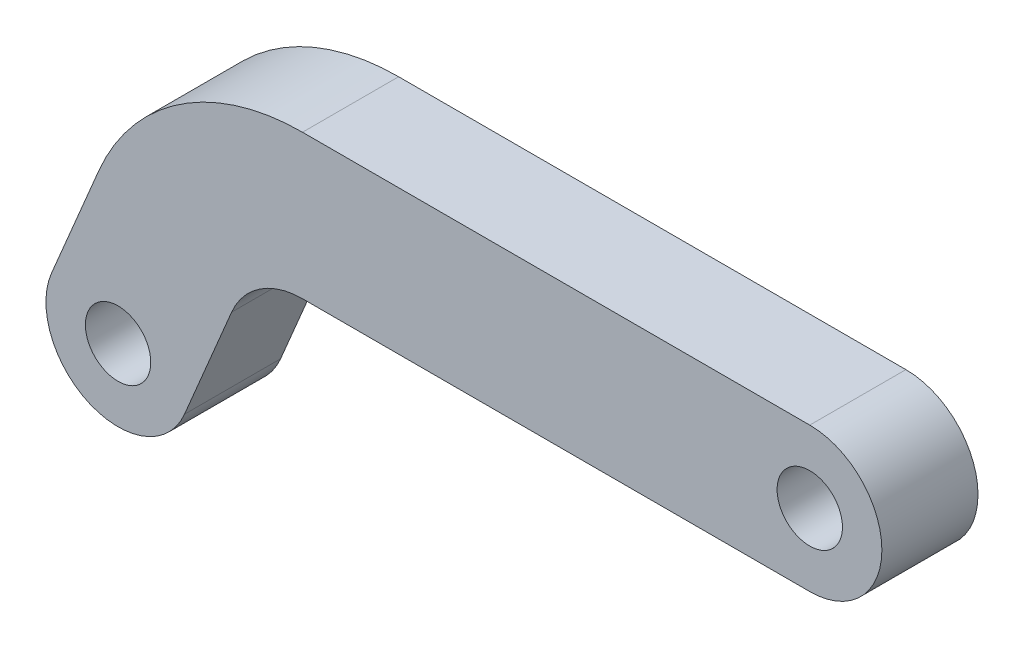
from build123d import *

# Parameters (mm, degrees)
SKETCH1_R           = 2.159
BOSS_EXTRUDE1_DEPTH = 3.175


with BuildPart() as part:
    # Sketch1 → Boss-Extrude1 (new, symmetric)
    with BuildSketch(Plane.XY):
        with BuildLine():
            Line((45.694655294, 18.184090909), (12.185241412, 18.184090909))
            ThreePointArc((12.185241412, 18.184090909), (4.105741291, 15.745754494), (-1.275978706, 9.244916351))
            Line((-1.275978706, 9.244916351), (-4.389528299, 1.847551775))
            ThreePointArc((-4.389528299, 1.847551775), (-1.847551775, -4.389528299), (4.389528299, -1.847551775))
            Line((4.389528299, -1.847551775), (7.503077893, 5.549812802))
            ThreePointArc((7.503077893, 5.549812802), (9.3749805, 7.810973895), (12.185241412, 8.659090909))
            Line((12.185241412, 8.659090909), (45.694655294, 8.659090909))
            ThreePointArc((45.694655294, 8.659090909), (50.457155294, 13.421590909), (45.694655294, 18.184090909))
        make_face()
        Circle(SKETCH1_R, mode=Mode.SUBTRACT)
        with Locations((45.694655294, 13.421590909)):
            Circle(SKETCH1_R, mode=Mode.SUBTRACT)
    extrude(amount=BOSS_EXTRUDE1_DEPTH, both=True)


solid = part.part
